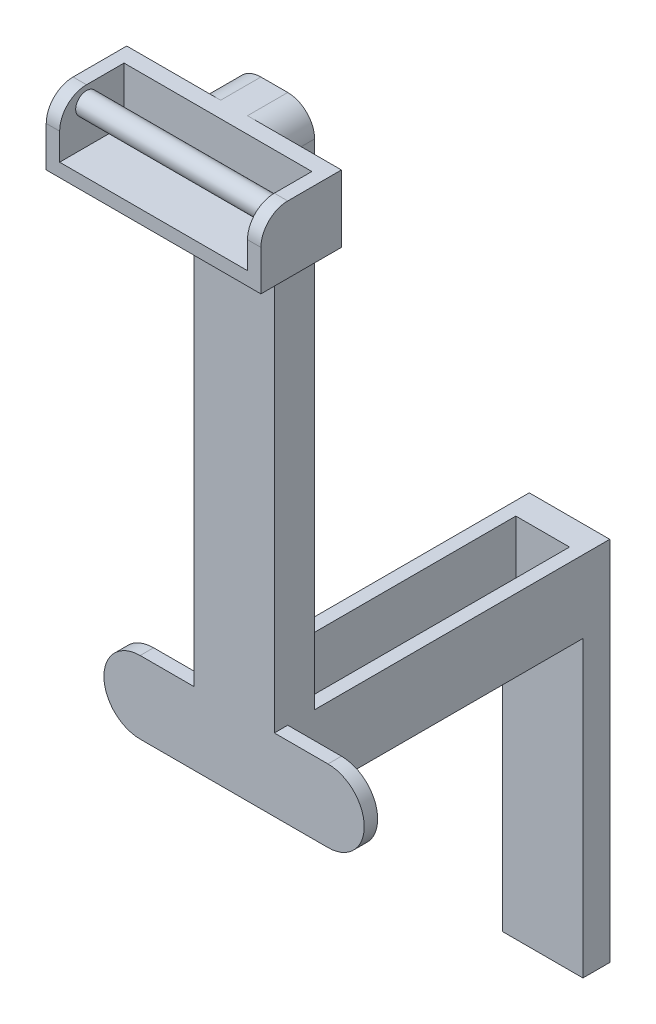
from build123d import *

# Parameters (mm, degrees)
EXTRUDE1_DEPTH = 15
FILLET1_R      = 10
EXTRUDE2_DEPTH = 10
SKETCH3_W      = 80
SKETCH3_H      = 25
EXTRUDE3_DEPTH = 30
SKETCH5_W      = 70
SKETCH5_H      = 20
EXTRUDE4_DEPTH = 24
FILLET2_R      = 10
EXTRUDE5_REACH = 432.349
SKETCH6_R      = 4.029178008
SKETCH7_W      = 30
SKETCH7_H      = 263.372286267
EXTRUDE6_DEPTH = 427.91910061
EXTRUDE7_DEPTH = 100
SKETCH9_W      = 30
SKETCH9_H      = 136.58118173
EXTRUDE8_DEPTH = 10


with BuildPart() as part:
    # Sketch1 → Extrude1 (new body)
    with BuildSketch(Plane.XY):
        with BuildLine():
            Line((0, -62.834984228), (30, -62.834984228))
            Line((30, -62.834984228), (30, 198.565015772))
            Line((30, 198.565015772), (50, 198.565015772))
            ThreePointArc((50, 198.565015772), (63.5, 212.065015772), (50, 225.565015772))
            Line((50, 225.565015772), (30, 225.565015772))
            Line((30, 225.565015772), (30, 419.765015772))
            Line((30, 419.765015772), (0, 419.765015772))
            Line((0, 419.765015772), (0, 225.565015772))
            Line((0, 225.565015772), (-20, 225.565015772))
            ThreePointArc((-20, 225.565015772), (-33.5, 212.065015772), (-20, 198.565015772))
            Line((-20, 198.565015772), (0, 198.565015772))
            Line((0, 198.565015772), (0, -62.834984228))
        make_face()
    extrude(amount=EXTRUDE1_DEPTH)

    # Fillet1
    fillet1_edges = [part.edges().sort_by_distance(p)[0] for p in [
        (30, -62.834984228, 7.5),
        (0, -62.834984228, 7.5),
        (0, 419.765015772, 7.5),
        (30, 419.765015772, 7.5),
    ]]
    fillet(fillet1_edges, radius=FILLET1_R)

    # Sketch2 → Extrude2 (cut)
    with BuildSketch(Plane(origin=(0, 0, 0), x_dir=(-1, 0, 0), z_dir=(0, 0, -1))):
        with BuildLine():
            Line((-50, 225.565015772), (-30, 225.565015772))
            Line((-30, 225.565015772), (-30, 198.565015772))
            Line((-30, 198.565015772), (-50, 198.565015772))
            ThreePointArc((-50, 198.565015772), (-63.5, 212.065015772), (-50, 225.565015772))
        make_face()
        with BuildLine():
            Line((0, 198.565015772), (20, 198.565015772))
            ThreePointArc((20, 198.565015772), (33.5, 212.065015772), (20, 225.565015772))
            Line((20, 225.565015772), (0, 225.565015772))
            Line((0, 225.565015772), (0, 198.565015772))
        make_face()
    extrude(amount=-EXTRUDE2_DEPTH, mode=Mode.SUBTRACT)

    # Sketch3 → Extrude3 (add)
    with BuildSketch(Plane.XY.offset(15)):
        with Locations((15, 407.265015772)):
            Rectangle(SKETCH3_W, SKETCH3_H)
    extrude(amount=EXTRUDE3_DEPTH)

    # Sketch5 → Extrude4 (cut)
    with BuildSketch(Plane.XY.offset(45)):
        with Locations((15, 409.765015772)):
            Rectangle(SKETCH5_W, SKETCH5_H)
    extrude(amount=-EXTRUDE4_DEPTH, mode=Mode.SUBTRACT)

    # Fillet2
    fillet2_edges = [part.edges().sort_by_distance(p)[0] for p in [
        (-22.5, 419.765015772, 45),
        (52.5, 419.765015772, 45),
    ]]
    fillet(fillet2_edges, radius=FILLET2_R)

    # Sketch6 → Extrude5 (add, up to next)
    with BuildSketch(Plane.ZY.offset(-50), mode=Mode.PRIVATE) as extrude5_sk1:
        with Locations((35, 413.847695375)):
            Circle(SKETCH6_R)
    extrude5_tool1 = extrude(extrude5_sk1.sketch, amount=EXTRUDE5_REACH, mode=Mode.PRIVATE) - part.part
    add(extrude5_tool1.solids().sort_by_distance((50, 413.847695, 35))[0])

    # Sketch7 → Extrude6 (cut, through all)
    with BuildSketch(Plane(origin=(0, 0, 0), x_dir=(-1, 0, 0), z_dir=(0, 0, -1))):
        with Locations((-15, 66.878872639)):
            Rectangle(SKETCH7_W, SKETCH7_H)
    extrude(amount=-EXTRUDE6_DEPTH, mode=Mode.SUBTRACT)

    # Sketch8 → Extrude7 (add)
    with BuildSketch(Plane(origin=(0, 0, 0), x_dir=(-1, 0, 0), z_dir=(0, 0, -1))):
        Polygon((-30, 198.565015772), (0, 198.565015772), (0, 225.565015772), (-5, 225.565015772), (-5, 203.565015772), (-25, 203.565015772), (-25, 225.565015772), (-30, 225.565015772), align=None)
    extrude(amount=EXTRUDE7_DEPTH)

    # Sketch9 → Extrude8 (add)
    with BuildSketch(Plane(origin=(0, 0, -100), x_dir=(-1, 0, 0), z_dir=(0, 0, -1))):
        with Locations((-15, 157.274424907)):
            Rectangle(SKETCH9_W, SKETCH9_H)
    extrude(amount=EXTRUDE8_DEPTH)


solid = part.part
